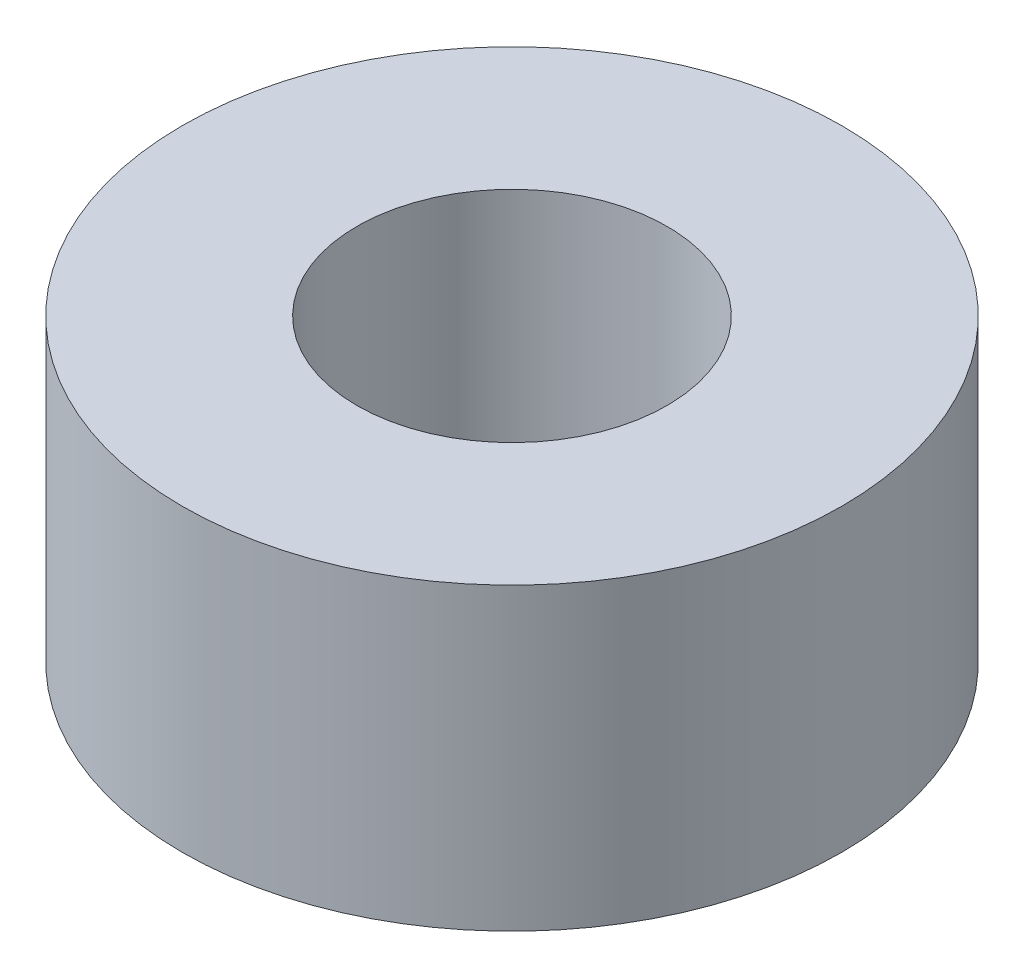
from build123d import *

# Parameters (mm, degrees)
SKETCH1_R           = 4.675
SKETCH1_R_2         = 2.2
BOSS_EXTRUDE1_DEPTH = 4.25


with BuildPart() as part:
    # Sketch1 → Boss-Extrude1 (new body)
    with BuildSketch(Plane(origin=(0, 0, 0), x_dir=(1, 0, 0), z_dir=(0, 1, 0))):
        Circle(SKETCH1_R)
        Circle(SKETCH1_R_2, mode=Mode.SUBTRACT)
    extrude(amount=BOSS_EXTRUDE1_DEPTH)


solid = part.part
